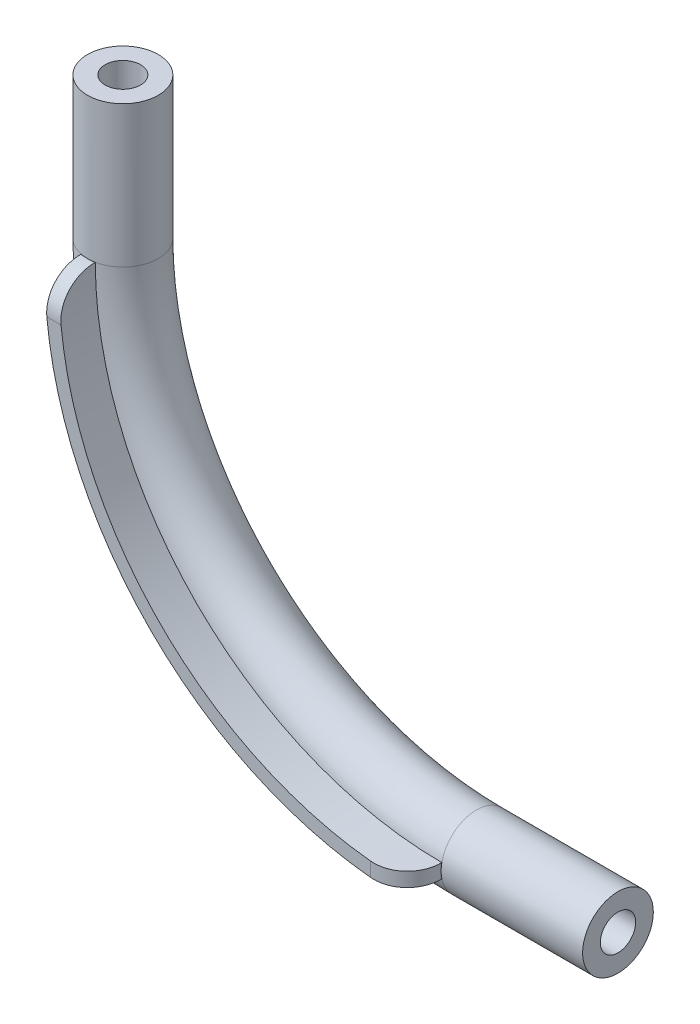
from build123d import *

# Parameters (mm, degrees)
SKETCH_4_R      = 5
REVOLVE_1_ANGLE = 90
SKETCH_5_R      = 5
SKETCH_5_R_2    = 2.5
EXTRUDE_4_DEPTH = 20
SKETCH_6_R      = 5
SKETCH_6_R_2    = 2.5
EXTRUDE_5_DEPTH = 20
EXTRUDE_6_DEPTH = 10
FILLET_1_R      = 5


with BuildPart() as part:
    # 草圖4 → 旋轉1 (revolve)
    with BuildSketch(Plane(origin=(0, 0, 0), x_dir=(1, 0, 0), z_dir=(0, 1, 0))):
        with Locations((-50, 0)):
            Circle(SKETCH_4_R)
    revolve(axis=Axis((0, 0, -3.474942085), (0, 0, 1)), revolution_arc=REVOLVE_1_ANGLE)

    # 草圖5 → 填料-伸長4 (add)
    with BuildSketch(Plane(origin=(0, 0, 0), x_dir=(0, 0, -1), z_dir=(1, 0, 0))):
        with Locations(Location((0, -50, 0), (0, 0, 270))):
            Circle(SKETCH_5_R)
        with Locations(Location((0, -50, 0), (0, 0, 90))):
            Circle(SKETCH_5_R_2, mode=Mode.SUBTRACT)
    extrude(amount=EXTRUDE_4_DEPTH)

    # 草圖6 → 填料-伸長5 (add)
    with BuildSketch(Plane(origin=(0, 0, 0), x_dir=(1, 0, 0), z_dir=(0, 1, 0))):
        with Locations(Location((-50, 0, 0), (0, 0, 180))):
            Circle(SKETCH_6_R)
        with Locations(Location((-50, 0, 0), (0, 0, 270))):
            Circle(SKETCH_6_R_2, mode=Mode.SUBTRACT)
    extrude(amount=EXTRUDE_5_DEPTH)

    # 草圖7 → 填料-伸長6 (add)
    with BuildSketch(Plane.XY):
        with BuildLine():
            Line((-49, 0), (-51, 0))
            ThreePointArc((-51, 0), (-36.062445841, -36.062445841), (0, -51))
            Line((0, -51), (0, -49))
            ThreePointArc((0, -49), (-34.648232278, -34.648232278), (-49, 0))
        make_face()
    extrude(amount=EXTRUDE_6_DEPTH)

    # 圓角1
    fillet_1_edges = [part.edges().sort_by_distance(p)[0] for p in [
        (-50, 0, 10),
        (0, -50, 10),
    ]]
    fillet(fillet_1_edges, radius=FILLET_1_R - 0.0001)  # a hair under: the kernel refuses the full size


solid = part.part
